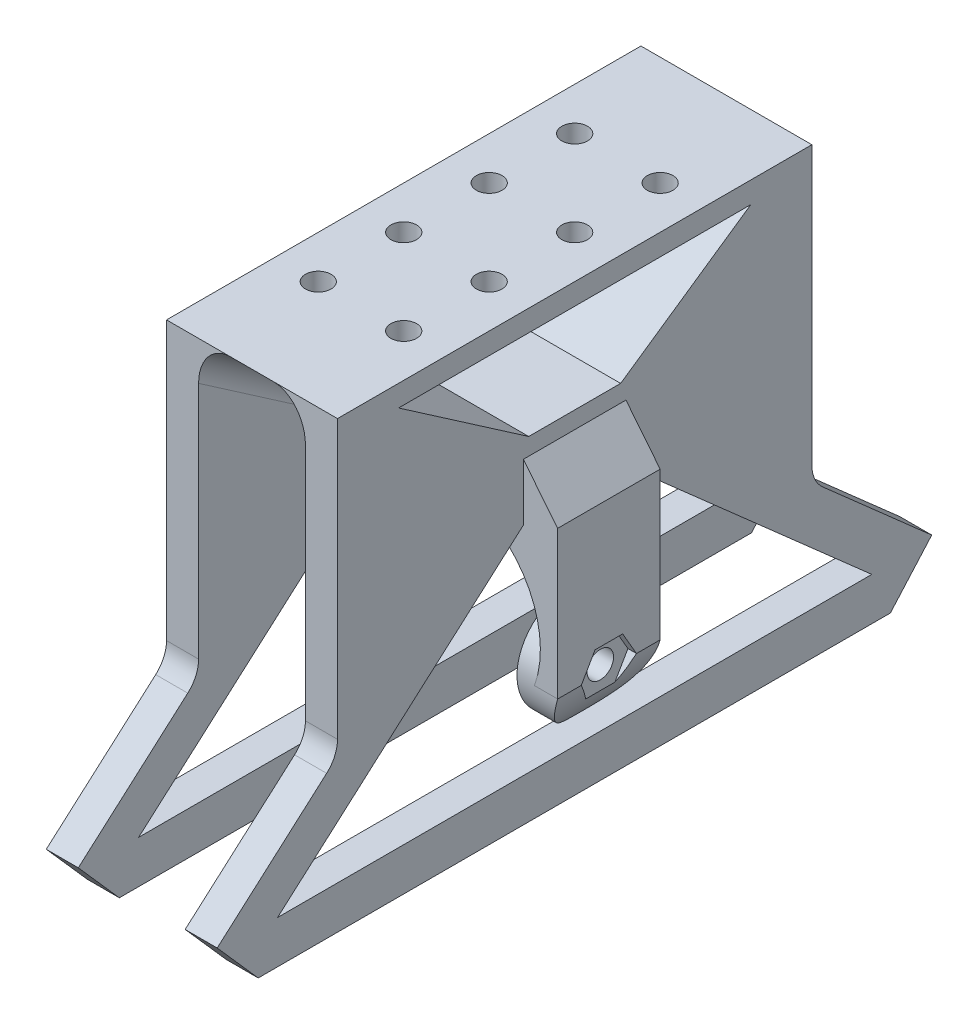
from build123d import *

# Parameters (mm, degrees)
EXTRUDE_1_DEPTH      = 12
EXTRUDE_2_REACH      = 35.545
EXTRUDE_2_END_RADIUS = 11.985372339
SKETCH_2_R           = 6
MIRROR_START         = 9.249795062
MIRROR_1_DEPTH       = 2.735782315
MIRROR_1_2_DEPTH     = 0.000409876
CUT_EXTRUDE_1_DEPTH  = 34.545141776
CUT_EXTRUDE_2_DEPTH  = 1
CUT_EXTRUDE_3_DEPTH  = 1
MIRROR_START_2       = 9.250204938
MIRROR_3_DEPTH       = 5.749795062
SKETCH_6_R           = 1.55
CUT_EXTRUDE_4_DEPTH  = 37.245193425
SKETCH_12_W          = 20
SKETCH_12_H          = 12
EXTRUDE_4_DEPTH      = 5
EXTRUDE_5_DEPTH      = 10
EXTRUDE_6_DEPTH      = 12
EXTRUDE_7_DEPTH      = 3.75
EXTRUDE_8_DEPTH      = 3.75
FILLET_1_R           = 3.75
FILLET_2_R           = 3.75
SKETCH_21_R          = 1.5
CUT_EXTRUDE_5_DEPTH  = 3


with BuildPart() as part:
    # 스케치1 → 보스-돌출1 (new body)
    with BuildSketch(Plane.XY):
        with BuildLine():
            Line((14.000204938, 2.291069809), (-13.999795062, 2.291069809))
            Line((-13.999795062, 2.291069809), (-13.999795062, -6.939240191))
            Line((-13.999795062, -6.939240191), (-13.999795062, -15.005030191))
            ThreePointArc((-13.999795062, -15.005030191), (-12.699794, -18.209549332), (-10.647895062, -20.993190191))
            Line((-10.647895062, -20.993190191), (-9.249795062, -20.993190191))
            Line((-9.249795062, -20.993190191), (-9.249795062, -18.61185417))
            ThreePointArc((-9.249795062, -18.61185417), (-10.428409882, -16.897436148), (-11.292795062, -15.005030191))
            ThreePointArc((-11.292795062, -15.005030191), (0.000204938, 0.99497801), (11.293204938, -15.005030191))
            ThreePointArc((11.293204938, -15.005030191), (10.428819757, -16.897436148), (9.250204938, -18.61185417))
            Line((9.250204938, -18.61185417), (9.250204938, -20.993190191))
            Line((9.250204938, -20.993190191), (10.648304938, -20.993190191))
            ThreePointArc((10.648304938, -20.993190191), (12.700203875, -18.209549332), (14.000204938, -15.005030191))
            Line((14.000204938, -15.005030191), (14.000204938, -6.939240191))
            Line((14.000204938, -6.939240191), (14.000204938, 2.291069809))
        make_face()
    extrude(amount=EXTRUDE_1_DEPTH)

    # 보스-돌출2: up to this cylinder (the profile starts inside it)
    extrude_2_end = Plane(origin=(0.000204938, -10.990394329, 6), z_dir=(0, 0, -1)) * Cylinder(EXTRUDE_2_END_RADIUS, 96.060744678, mode=Mode.PRIVATE)
    # 스케치2 → 보스-돌출2 (add, up to the surface)
    with BuildSketch(Plane(origin=(-9.249795062, 0, 0), x_dir=(0, 0, -1), z_dir=(1, 0, 0)), mode=Mode.PRIVATE) as extrude_2_sk1:
        with Locations((-6, -14.993190191)):
            Circle(SKETCH_2_R)
    extrude_2_tool1 = extrude(extrude_2_sk1.sketch, amount=-EXTRUDE_2_REACH, mode=Mode.PRIVATE) & extrude_2_end
    add(extrude_2_tool1.solids().sort_by_distance((-9.249795, -14.99319, 6))[0])

    # 대칭 복사1: read off the stored shape, not the designer's step
    # 대칭 복사1 outline → 대칭 복사1 (add)
    with BuildSketch(Plane.YZ.offset(MIRROR_START)):
        with BuildLine():
            ThreePointArc((-18.61185417, 1.214054847), (-8.993190191, 6), (-18.61185417, 10.785945153))
            Line((-18.61185417, 10.785945153), (-18.61185417, 1.214054847))
        make_face()
    extrude(amount=MIRROR_1_DEPTH)

    # Mirror 1 2 outline → Mirror 1 2 (add)
    with BuildSketch(Plane.YZ.offset(MIRROR_START)):
        with BuildLine():
            Line((-18.61185417, 1.214054847), (-18.61185417, 10.785945153))
            ThreePointArc((-18.61185417, 10.785945153), (-20.993190191, 6), (-18.61185417, 1.214054847))
        make_face()
    extrude(amount=MIRROR_1_2_DEPTH)

    # 스케치3 → 컷-돌출1 (cut, through all)
    with BuildSketch(Plane(origin=(-9.249795062, 0, 0), x_dir=(0, 0, -1), z_dir=(1, 0, 0))):
        with BuildLine():
            Line((-6, -20.993190191), (0, -20.993190191))
            Line((0, -20.993190191), (0, -18.61185417))
            Line((0, -18.61185417), (-1.214054847, -18.61185417))
            ThreePointArc((-1.214054847, -18.61185417), (-3.327172272, -20.364967545), (-6, -20.993190191))
        make_face()
        with BuildLine():
            Line((-12, -20.993190191), (-6, -20.993190191))
            ThreePointArc((-6, -20.993190191), (-8.672827728, -20.364967545), (-10.785945153, -18.61185417))
            Line((-10.785945153, -18.61185417), (-12, -18.61185417))
            Line((-12, -18.61185417), (-12, -20.993190191))
        make_face()
        with BuildLine():
            Line((-12, -18.61185417), (-10.785945153, -18.61185417))
            ThreePointArc((-10.785945153, -18.61185417), (-11.688394805, -16.901635773), (-12, -14.993190191))
            Line((-12, -14.993190191), (-12, -18.61185417))
        make_face()
        with BuildLine():
            Line((-1.214054847, -18.61185417), (0, -18.61185417))
            Line((0, -18.61185417), (0, -14.993190191))
            ThreePointArc((0, -14.993190191), (-0.311605195, -16.901635773), (-1.214054847, -18.61185417))
        make_face()
    extrude(amount=-CUT_EXTRUDE_1_DEPTH, mode=Mode.SUBTRACT)

    # 스케치4 → 컷-돌출2 (cut)
    with BuildSketch(Plane.ZY.offset(13.999795062)):
        Polygon((9.23, -15.005030191), (7.615, -12.207768137), (4.385, -12.207768137), (2.77, -15.005030191), (4.385, -17.802292245), (7.615, -17.802292245), align=None)
    extrude(amount=-CUT_EXTRUDE_2_DEPTH, mode=Mode.SUBTRACT)

    # 스케치5 → 컷-돌출3 (cut)
    with BuildSketch(Plane(origin=(14.000204938, 0, 0), x_dir=(0, 0, -1), z_dir=(1, 0, 0))):
        Polygon((-2.77, -15.005030191), (-4.385, -12.207768137), (-7.615, -12.207768137), (-9.23, -15.005030191), (-7.615, -17.802292245), (-4.385, -17.802292245), align=None)
    extrude(amount=-CUT_EXTRUDE_3_DEPTH, mode=Mode.SUBTRACT)

    # 대칭 복사3: read off the stored shape, not the designer's step
    # 대칭 복사3 outline → 대칭 복사3 (cut)
    with BuildSketch(Plane.YZ.offset(MIRROR_START_2)):
        with BuildLine():
            ThreePointArc((-20.993190191, 6), (-19.235830878, 10.242640687), (-14.993190191, 12))
            Line((-14.993190191, 12), (-20.993190191, 12))
            Line((-20.993190191, 12), (-20.993190191, 6))
        make_face()
        with BuildLine():
            Line((-20.993190191, 0), (-14.993190191, 0))
            ThreePointArc((-14.993190191, 0), (-19.235830878, 1.757359313), (-20.993190191, 6))
            Line((-20.993190191, 6), (-20.993190191, 0))
        make_face()
    extrude(amount=MIRROR_3_DEPTH, mode=Mode.SUBTRACT)

    # 스케치6 → 컷-돌출4 (cut, through all)
    with BuildSketch(Plane.ZY.offset(12.999795062)):
        with Locations((6, -15.005030191)):
            Circle(SKETCH_6_R)
    extrude(amount=-CUT_EXTRUDE_4_DEPTH, mode=Mode.SUBTRACT)

    # 스케치12 → 보스-돌출4 (add)
    with BuildSketch(Plane(origin=(0, 2.291069809, 0), x_dir=(1, 0, 0), z_dir=(0, 1, 0))):
        with Locations((0, -6)):
            Rectangle(SKETCH_12_W, SKETCH_12_H)
    extrude(amount=EXTRUDE_4_DEPTH)

    # 스케치14 → 보스-돌출5 (add, symmetric)
    with BuildSketch(Plane(origin=(0, 0, 0), x_dir=(0, 0, -1), z_dir=(1, 0, 0))):
        Polygon((-12, 7.291069809), (0, 7.291069809), (21.75, 22.291069809), (-33.75, 22.291069809), align=None)
        Polygon((-11.377217009, 9.291069809), (-0.622782991, 9.291069809), (14.602217009, 19.791069809), (-26.602217009, 19.791069809), align=None, mode=Mode.SUBTRACT)
    extrude(amount=EXTRUDE_5_DEPTH, both=True)

    # 스케치15 → 보스-돌출6 (add)
    with BuildSketch(Plane.XY.offset(12)):
        Polygon((-10, 7.291069809), (-13.999795062, 2.291069809), (-10, 2.291069809), align=None)
        Polygon((10, 2.291069809), (14.000204938, 2.291069809), (10, 7.291069809), align=None)
    extrude(amount=-EXTRUDE_6_DEPTH)

    # 스케치19 → 보스-돌출7 (add)
    with BuildSketch(Plane(origin=(6.25, 0, 0), x_dir=(0, 0, -1), z_dir=(1, 0, 0))):
        Polygon((-12, 7.291069809), (-47.823129142, -24.313497594), (-43.022395989, -29.755030191), (30.938064105, -29.755030191), (35.775707613, -24.271660464), (0, 7.291069809), (0, 0.623337928), (28.765859914, -24.755030191), (-40.765859914, -24.755030191), (-12, 0.623337928), align=None)
    extrude_7 = extrude(amount=EXTRUDE_7_DEPTH)

    # 대칭 복사4: 보스-돌출7 across plane
    add(extrude_7.mirror(Plane(origin=(0, 0, 0), x_dir=(0, 0, 1), z_dir=(1, 0, 0))))

    # 스케치20 → 보스-돌출8 (add)
    with BuildSketch(Plane(origin=(10, 0, 0), x_dir=(0, 0, -1), z_dir=(1, 0, 0))):
        Polygon((-12, 7.291069809), (-33.75, 22.291069809), (-33.75, -11.897631945), align=None)
        Polygon((21.75, 22.291069809), (21.75, -11.897631945), (0, 7.291069809), align=None)
    extrude_8 = extrude(amount=-EXTRUDE_8_DEPTH)

    # 대칭 복사5: 보스-돌출8 across plane
    add(extrude_8.mirror(Plane(origin=(0, 0, 0), x_dir=(0, 0, 1), z_dir=(1, 0, 0))))

    # 필렛1
    # the kernel refuses this fillet: 3.75 mm, written as the material it adds along each edge
    with BuildSketch(Plane(origin=(-6.25, 7.291069809, 0), x_dir=(0, -1, 0), z_dir=(1, 0, 0))) as fillet_1_piece_1_section:
        with BuildLine():
            CenterArc((FILLET_1_R * 0.525097583021, FILLET_1_R), FILLET_1_R, 214.592288688, 55.407711312)
            Line((-FILLET_1_R * 0.298115202894, FILLET_1_R * 0.432267044196), (0, 0))
            Line((0, 0), (FILLET_1_R * 0.525097583021, 0))
        make_face()
    fillet_1_piece_1 = extrude(amount=17.422789841, mode=Mode.PRIVATE)
    fillet_1_piece_1 = split(fillet_1_piece_1, bisect_by=Plane(origin=(10, 7.291069809, 0), z_dir=(-1, 0, 0)), keep=Keep.TOP, mode=Mode.PRIVATE)
    add(fillet_1_piece_1)
    with BuildSketch(Plane(origin=(11.172789841, 7.291069809, 12), x_dir=(0, -1, 0), z_dir=(-1, 0, 0))) as fillet_1_piece_2_section:
        with BuildLine():
            CenterArc((FILLET_1_R * 0.525097583021, FILLET_1_R), FILLET_1_R, 214.592288688, 55.407711312)
            Line((-FILLET_1_R * 0.298115202894, FILLET_1_R * 0.432267044196), (0, 0))
            Line((0, 0), (FILLET_1_R * 0.525097583021, 0))
        make_face()
    fillet_1_piece_2 = extrude(amount=17.422789841, mode=Mode.PRIVATE)
    fillet_1_piece_2 = split(fillet_1_piece_2, bisect_by=Plane(origin=(10, 7.291069809, 12), z_dir=(-1, 0, 0)), keep=Keep.TOP, mode=Mode.PRIVATE)
    add(fillet_1_piece_2)
    with BuildSketch(Plane(origin=(6.25, 1.968573348, 4.282380132), x_dir=(-1, 0, 0), z_dir=(0, 0.5677329558036596, 0.8232127859153063))) as fillet_1_piece_3_section:
        with BuildLine():
            CenterArc((FILLET_1_R, FILLET_1_R), FILLET_1_R, 180, 90)
            Line((0, FILLET_1_R), (0, 0))
            Line((0, 0), (FILLET_1_R, 0))
        make_face()
    fillet_1_piece_3 = extrude(amount=45.170872431, mode=Mode.PRIVATE)
    fillet_1_piece_3 = split(fillet_1_piece_3, bisect_by=Plane(origin=(6.25, 1.968573348, 12), z_dir=(0, 0, 1)), keep=Keep.TOP, mode=Mode.PRIVATE)
    fillet_1_piece_3 = split(fillet_1_piece_3, bisect_by=Plane(origin=(6.25, 1.968573348, 33.75), z_dir=(0, 0, -1)), keep=Keep.TOP, mode=Mode.PRIVATE)
    add(fillet_1_piece_3)
    with BuildSketch(Plane(origin=(6.25, 1.968573348, 7.717619868), x_dir=(0, -0.8232127859153062, -0.5677329558036597), z_dir=(0, 0.5677329558036597, -0.8232127859153062))) as fillet_1_piece_4_section:
        with BuildLine():
            CenterArc((FILLET_1_R, FILLET_1_R), FILLET_1_R, 180, 90)
            Line((0, FILLET_1_R), (0, 0))
            Line((0, 0), (FILLET_1_R, 0))
        make_face()
    fillet_1_piece_4 = extrude(amount=45.170872431, mode=Mode.PRIVATE)
    fillet_1_piece_4 = split(fillet_1_piece_4, bisect_by=Plane(origin=(6.25, 1.968573348, 0), z_dir=(0, 0, -1)), keep=Keep.TOP, mode=Mode.PRIVATE)
    fillet_1_piece_4 = split(fillet_1_piece_4, bisect_by=Plane(origin=(6.25, 1.968573348, -21.75), z_dir=(0, 0, 1)), keep=Keep.TOP, mode=Mode.PRIVATE)
    add(fillet_1_piece_4)
    with BuildSketch(Plane(origin=(-6.25, 1.968573348, 4.282380132), x_dir=(0, -0.8232127859153063, 0.5677329558036595), z_dir=(0, 0.5677329558036596, 0.8232127859153063))) as fillet_1_piece_5_section:
        with BuildLine():
            CenterArc((FILLET_1_R, FILLET_1_R), FILLET_1_R, 180, 90)
            Line((0, FILLET_1_R), (0, 0))
            Line((0, 0), (FILLET_1_R, 0))
        make_face()
    fillet_1_piece_5 = extrude(amount=45.170872431, mode=Mode.PRIVATE)
    fillet_1_piece_5 = split(fillet_1_piece_5, bisect_by=Plane(origin=(-6.25, 1.968573348, 12), z_dir=(0, 0, 1)), keep=Keep.TOP, mode=Mode.PRIVATE)
    fillet_1_piece_5 = split(fillet_1_piece_5, bisect_by=Plane(origin=(-6.25, 1.968573348, 33.75), z_dir=(0, 0, -1)), keep=Keep.TOP, mode=Mode.PRIVATE)
    add(fillet_1_piece_5)
    with BuildSketch(Plane(origin=(-6.25, 1.968573348, 7.717619868), x_dir=(0, -0.8232127859153062, -0.5677329558036597), z_dir=(0, 0.5677329558036597, -0.8232127859153062))) as fillet_1_piece_6_section:
        with BuildLine():
            CenterArc((FILLET_1_R, -FILLET_1_R), FILLET_1_R, 90, 90)
            Line((0, -FILLET_1_R), (0, 0))
            Line((0, 0), (FILLET_1_R, 0))
        make_face()
    fillet_1_piece_6 = extrude(amount=45.170872431, mode=Mode.PRIVATE)
    fillet_1_piece_6 = split(fillet_1_piece_6, bisect_by=Plane(origin=(-6.25, 1.968573348, 0), z_dir=(0, 0, -1)), keep=Keep.TOP, mode=Mode.PRIVATE)
    fillet_1_piece_6 = split(fillet_1_piece_6, bisect_by=Plane(origin=(-6.25, 1.968573348, -21.75), z_dir=(0, 0, 1)), keep=Keep.TOP, mode=Mode.PRIVATE)
    add(fillet_1_piece_6)

    # 필렛2
    fillet_2_edges = [part.edges().sort_by_distance(p)[0] for p in [
        (8.125, -11.897631945, 33.75),
        (8.125, -11.897631945, -21.75),
        (-8.125, -11.897631945, 33.75),
        (-8.125, -11.897631945, -21.75),
    ]]
    fillet(fillet_2_edges, radius=FILLET_2_R)

    # 스케치21 → 컷-돌출5 (cut)
    with BuildSketch(Plane(origin=(0, 22.291069809, 0), x_dir=(1, 0, 0), z_dir=(0, 1, 0))):
        with Locations(Location((5, 9, 0), (0, 0, 270))):
            Circle(SKETCH_21_R)
        with Locations(Location((5, -1, 0), (0, 0, 270))):
            Circle(SKETCH_21_R)
        with Locations(Location((-5, 9, 0), (0, 0, 90))):
            Circle(SKETCH_21_R)
        with Locations(Location((-5, -1, 0), (0, 0, 90))):
            Circle(SKETCH_21_R)
        with Locations(Location((5, -11, 0), (0, 0, 90))):
            Circle(SKETCH_21_R)
        with Locations(Location((5, -21, 0), (0, 0, 90))):
            Circle(SKETCH_21_R)
        with Locations(Location((-5, -21, 0), (0, 0, 270))):
            Circle(SKETCH_21_R)
        with Locations(Location((-5, -11, 0), (0, 0, 270))):
            Circle(SKETCH_21_R)
    extrude(amount=-CUT_EXTRUDE_5_DEPTH, mode=Mode.SUBTRACT)


solid = part.part
